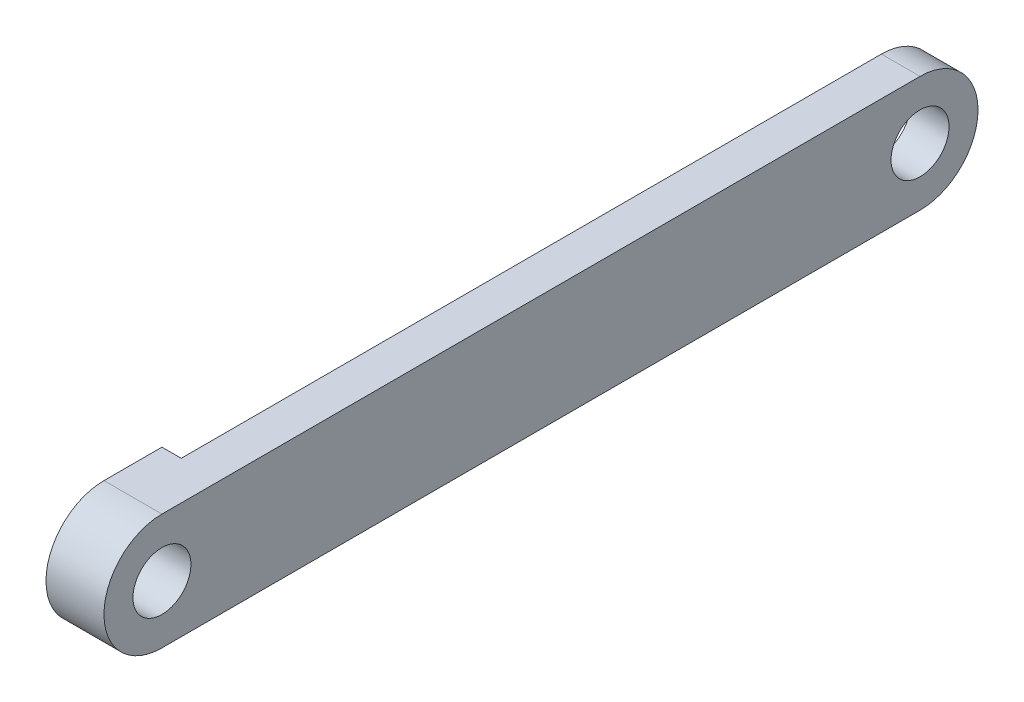
from build123d import *

# Parameters (mm, degrees)
SKETCH1_R           = 1.5
BOSS_EXTRUDE1_DEPTH = 3
SKETCH2_W           = 39.234
SKETCH2_H           = 6
CUT_EXTRUDE1_DEPTH  = 1


with BuildPart() as part:
    # Sketch1 → Boss-Extrude1 (new body)
    with BuildSketch(Plane(origin=(0, 0, 0), x_dir=(0, 0, -1), z_dir=(1, 0, 0))):
        with BuildLine():
            Line((0, -3), (39.234, -3))
            ThreePointArc((39.234, -3), (42.234, 0), (39.234, 3))
            Line((39.234, 3), (0, 3))
            ThreePointArc((0, 3), (-3, 0), (0, -3))
        make_face()
        Circle(SKETCH1_R, mode=Mode.SUBTRACT)
        with Locations((39.234, 0)):
            Circle(SKETCH1_R, mode=Mode.SUBTRACT)
    extrude(amount=BOSS_EXTRUDE1_DEPTH)

    # Sketch2 → Cut-Extrude1 (cut)
    with BuildSketch(Plane.ZY):
        with Locations((-22.617, 0)):
            Rectangle(SKETCH2_W, SKETCH2_H)
    extrude(amount=-CUT_EXTRUDE1_DEPTH, mode=Mode.SUBTRACT)


solid = part.part
